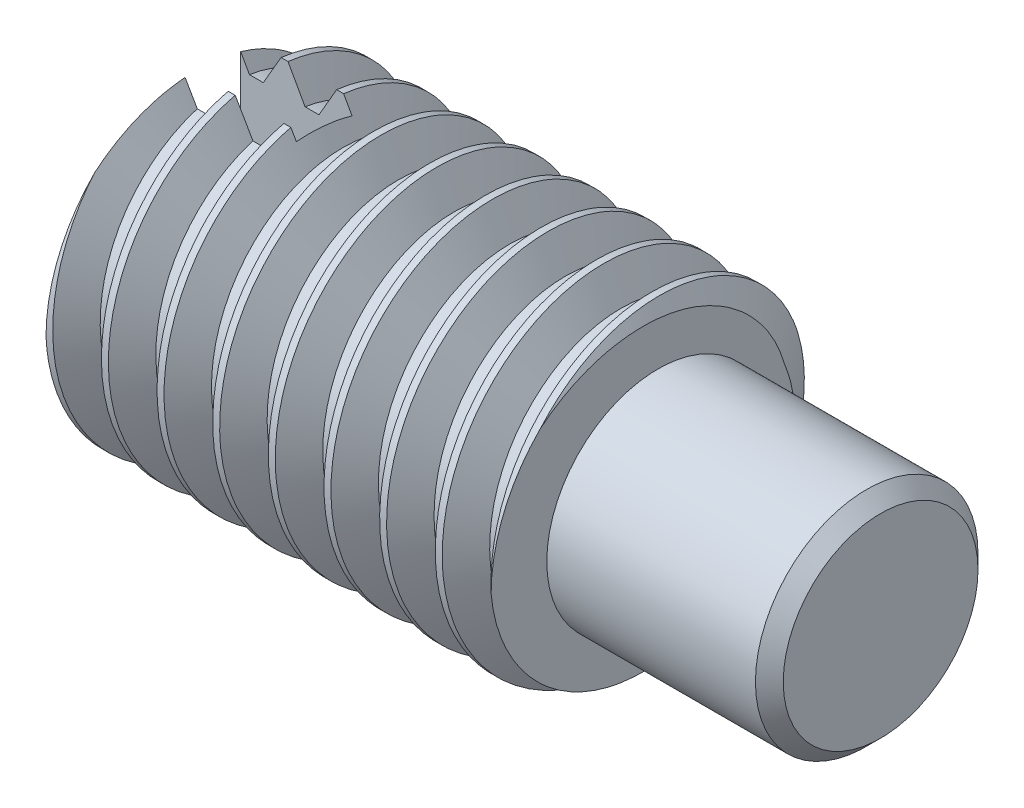
from build123d import *

# Parameters (mm, degrees)
SKETCH1_R           = 2
BOSS_EXTRUDE1_DEPTH = 12
SKETCH1_3_R         = 3
SKETCH1_3_R_2       = 2
BOSS_EXTRUDE2_DEPTH = 8
SKETCH2_W           = 1
SKETCH2_H           = 6.748907356
CUT_EXTRUDE1_DEPTH  = 2
THREAD1_PITCH       = 1
CHAMFER1_SIZE       = 0.25


with BuildPart() as part:
    # Sketch1 → Boss-Extrude1 (new body)
    with BuildSketch(Plane(origin=(0, 0, 0), x_dir=(0, 0, -1), z_dir=(1, 0, 0))):
        Circle(SKETCH1_R)
    extrude(amount=BOSS_EXTRUDE1_DEPTH)

    # Sketch1<3> → Boss-Extrude2 (add)
    with BuildSketch(Plane(origin=(0, 0, 0), x_dir=(0, 0, -1), z_dir=(1, 0, 0))):
        Circle(SKETCH1_3_R)
        Circle(SKETCH1_3_R_2, mode=Mode.SUBTRACT)
    extrude(amount=BOSS_EXTRUDE2_DEPTH)

    # Sketch2 → Cut-Extrude1 (cut)
    with BuildSketch(Plane.ZY):
        Rectangle(SKETCH2_W, SKETCH2_H)
    extrude(amount=-CUT_EXTRUDE1_DEPTH, mode=Mode.SUBTRACT)

    # Thread1: the profile of Thread Profile1 profile screwed along a right-hand helix of 10 turns, 8 arcs to a turn; built about Z, then put on its axis
    thread1_z = Axis((0, 0, 0), (0, 0, 1))
    thread1_corners = [(3.0003, 0, -0.000173205), (3.0003, 0, 0.875173202), (2.458734125, 0, 0.562499999), (2.458734125, 0, 0.312499999)]
    with BuildLine(mode=Mode.PRIVATE) as thread1_profile:
        Line(thread1_corners[0], thread1_corners[1])
        Line(thread1_corners[1], thread1_corners[2])
        Line(thread1_corners[2], thread1_corners[3])
        Line(thread1_corners[3], thread1_corners[0])
    thread1_cap = Face(thread1_profile.wire())
    thread1_turn_angles = [0, 22.5, 45, 67.5, 90, 112.5, 135, 157.5, 180, 202.5, 225, 247.5, 270, 292.5, 315, 337.5, 360]
    thread1_turn_weights = [1, 0.9238795325112867, 1, 0.9238795325112867, 1, 0.9238795325112867, 1, 0.9238795325112867, 1, 0.9238795325112867, 1, 0.9238795325112867, 1, 0.9238795325112867, 1, 0.9238795325112867, 1]
    thread1_turn_rails = [Edge.make_bspline([Vector(p[0], p[1], 0).rotate(thread1_z, thread1_turn_angles[k]) / thread1_turn_weights[k] + Vector(0, 0, p[2] + THREAD1_PITCH * thread1_turn_angles[k] / 360) for k in range(17)], [0, 0, 0, 1, 1, 2, 2, 3, 3, 4, 4, 5, 5, 6, 6, 7, 7, 8, 8, 8], 2, thread1_turn_weights) for p in thread1_corners]
    thread1_turn_sides = [Face.make_surface_from_curves(thread1_turn_rails[p[0]], thread1_turn_rails[p[1]]) for p in [(0, 1), (1, 2), (2, 3), (3, 0)]]
    thread1 = Plane(origin=(9, 0, 0), x_dir=(0, 0, 1), z_dir=(-1, 0, 0)) * Solid(Shell([*[p.moved(Location((0, 0, THREAD1_PITCH * i))) for i in range(10) for p in thread1_turn_sides], thread1_cap, thread1_cap.rotate(thread1_z, 3600).moved(Location((0, 0, THREAD1_PITCH * 3600 / 360)))]))
    add(thread1, mode=Mode.SUBTRACT)

    # Chamfer1
    chamfer1_edges = [part.edges().sort_by_distance(p)[0] for p in [
        (12, 0, 2),
    ]]
    chamfer(chamfer1_edges, length=CHAMFER1_SIZE)


solid = part.part
